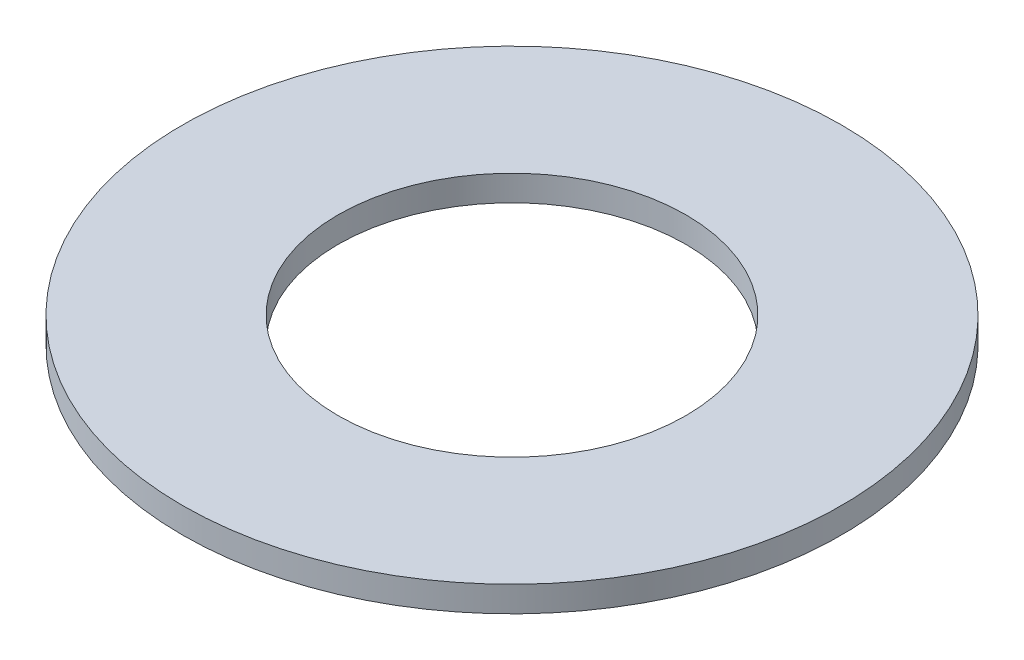
from build123d import *

# Parameters (mm, degrees)
SKETCH1_R           = 90
BOSS_EXTRUDE1_DEPTH = 7
SKETCH2_R           = 47.5
CUT_EXTRUDE1_DEPTH  = 128.471565457


with BuildPart() as part:
    # Sketch1 → Boss-Extrude1 (new body)
    with BuildSketch(Plane(origin=(0, 0, 0), x_dir=(1, 0, 0), z_dir=(0, 1, 0))):
        Circle(SKETCH1_R)
    extrude(amount=BOSS_EXTRUDE1_DEPTH)

    # Sketch2 → Cut-Extrude1 (cut, through all)
    with BuildSketch(Plane(origin=(0, 0, 0), x_dir=(1, 0, 0), z_dir=(0, 1, 0))):
        Circle(SKETCH2_R)
    extrude(amount=CUT_EXTRUDE1_DEPTH, mode=Mode.SUBTRACT)


solid = part.part
